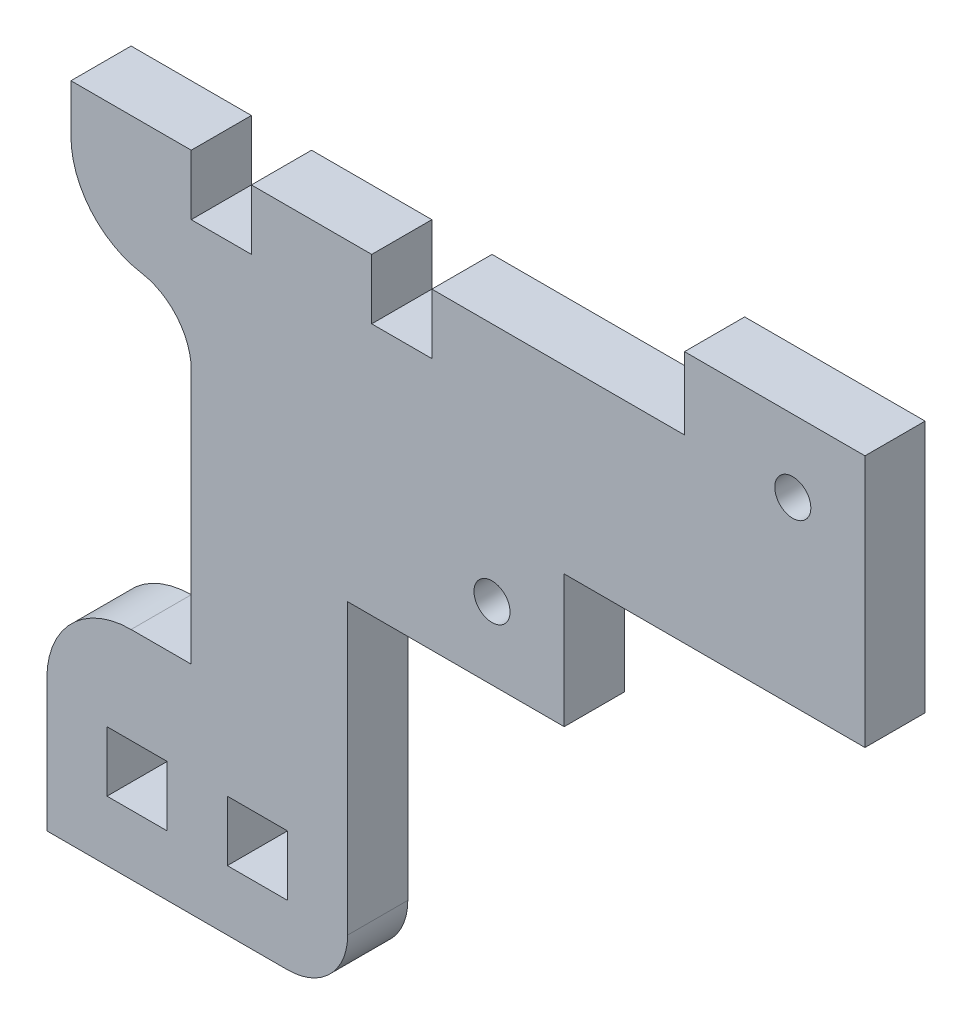
from build123d import *

# Parameters (mm, degrees)
ESQUISSE1_R        = 1.5
ESQUISSE1_W        = 5
ESQUISSE1_H        = 5
BOSS_EXTRU_1_DEPTH = 5
CONG_1_R           = 7
CONG_2_R           = 5
CONG_3_R           = 5


with BuildPart() as part:
    # Esquisse1 → Boss.-Extru.1 (new body)
    with BuildSketch(Plane.XY):
        Polygon((25, 19), (43, 19), (43, 30), (68, 30), (68, 51), (53, 51), (53, 45), (32, 45), (32, 40), (27, 40), (27, 45), (17, 45), (17, 40), (12, 40), (12, 45), (2, 45), (2, 40), (2, 34), (12, 34), (12, 8), (0, 8), (0, 0), (0, -5.810046935), (0, -10), (25, -10), (25, -4.928993292), align=None)
        with Locations((62, 45)):
            Circle(ESQUISSE1_R, mode=Mode.SUBTRACT)
        with Locations((37, 25)):
            Circle(ESQUISSE1_R, mode=Mode.SUBTRACT)
        with Locations((7.5, -2.5)):
            Rectangle(ESQUISSE1_W, ESQUISSE1_H, mode=Mode.SUBTRACT)
        with Locations((17.5, -2.5)):
            Rectangle(ESQUISSE1_W, ESQUISSE1_H, mode=Mode.SUBTRACT)
    extrude(amount=BOSS_EXTRU_1_DEPTH)

    # Congé1
    cong_1_edges = [part.edges().sort_by_distance(p)[0] for p in [
        (0, 8, 2.5),
        (2, 34, 2.5),
    ]]
    fillet(cong_1_edges, radius=CONG_1_R)

    # Congé2
    cong_2_edges = [part.edges().sort_by_distance(p)[0] for p in [
        (12, 34, 2.5),
    ]]
    fillet(cong_2_edges, radius=CONG_2_R)

    # Congé3
    cong_3_edges = [part.edges().sort_by_distance(p)[0] for p in [
        (25, -10, 2.5),
    ]]
    fillet(cong_3_edges, radius=CONG_3_R)


solid = part.part
